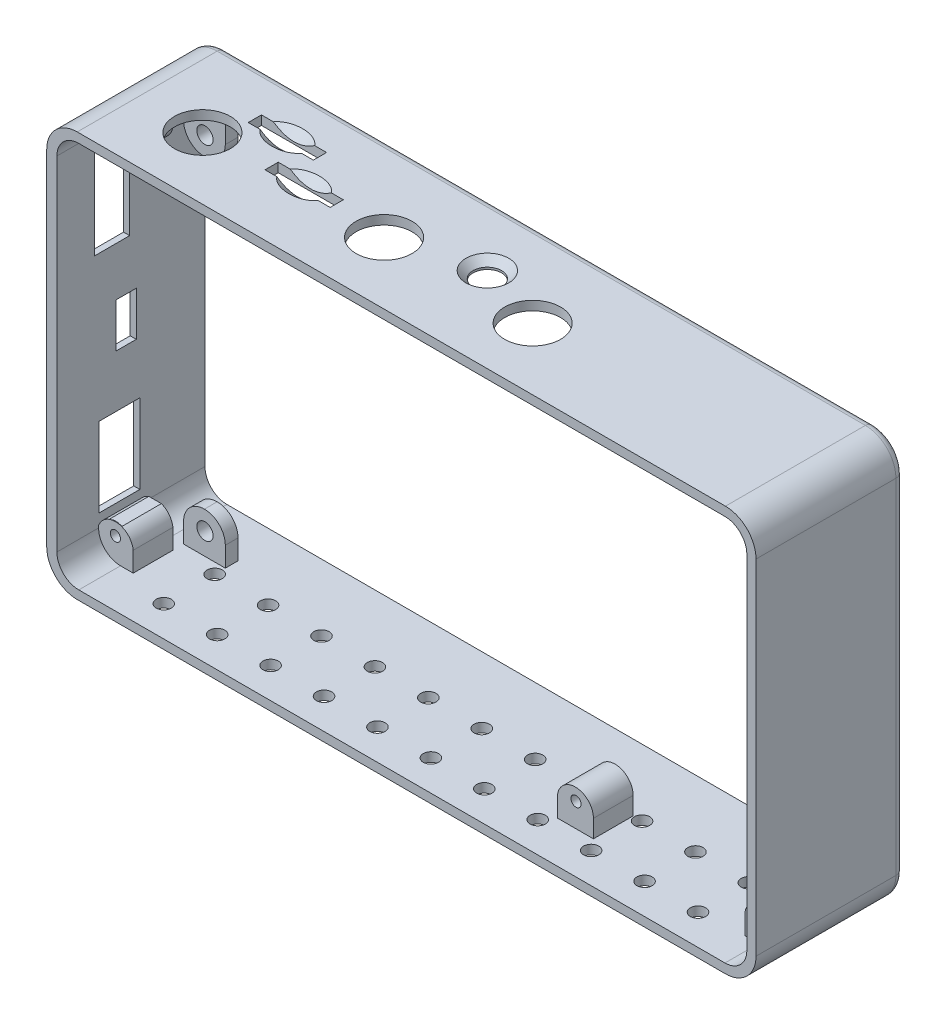
from build123d import *

# Parameters (mm, degrees)
SKETCH_2_W           = 139.4
SKETCH_2_H           = 79.6
SKETCH_2_W_2         = 135.6
SKETCH_2_H_2         = 76
EXTRUDE_1_DEPTH      = 29.1
FILLET_2_R           = 4.3
FILLET_3_R           = 6
FILLET_4_R           = 1.6
SKETCH_4_W           = 8.2
SKETCH_4_H           = 8
EXTRUDE_2_DEPTH      = 11
SKETCH_7_W           = 8.5
SKETCH_7_H           = 8
CUT_EXTRUDE_1_DEPTH  = 8.2
SKETCH_8_W           = 8.5
SKETCH_8_H           = 8
CUT_EXTRUDE_2_DEPTH  = 8.2
SKETCH_9_W           = 8.5
SKETCH_9_H           = 8
CUT_EXTRUDE_3_DEPTH  = 8.2
SKETCH_10_W          = 8.5
SKETCH_10_H          = 8
CUT_EXTRUDE_4_DEPTH  = 8.2
SKETCH_11_R          = 1.6
CUT_EXTRUDE_5_DEPTH  = 3
FILLET_5_R           = 4.1
EXTRUDE_3_DEPTH      = 16
EXTRUDE_3_2_DEPTH    = 16
EXTRUDE_3_3_DEPTH    = 16
EXTRUDE_3_4_DEPTH    = 16
EXTRUDE_3_5_DEPTH    = 16
EXTRUDE_3_6_DEPTH    = 16
CUT_EXTRUDE_6_DEPTH  = 8.2
SKETCH_14_R          = 1
CUT_EXTRUDE_7_DEPTH  = 8
EXTRUDE_START        = 1.6
SKETCH_15_R          = 1
EXTRUDE_4_DEPTH      = 1.6
SKETCH_16_R          = 5.5
SKETCH_16_R_2        = 2.8
SKETCH_16_W          = 12.8
SKETCH_16_H          = 2.6
CUT_EXTRUDE_9_DEPTH  = 2
SKETCH_17_RX         = 4.5
SKETCH_17_RY         = 3
CUT_EXTRUDE_10_DEPTH = 1.6
CUT_EXTRUDE_10_TAPER = 51
CHAMFER_1_SIZE       = 1.4
SKETCH_20_W          = 1.2
SKETCH_20_H          = 8
EXTRUDE_5_DEPTH      = 1.6
SKETCH_21_W          = 6.9
SKETCH_21_H          = 18.6
SKETCH_21_W_2        = 4
SKETCH_21_H_2        = 8.7
SKETCH_21_W_3        = 8
SKETCH_21_H_3        = 15.6
CUT_EXTRUDE_12_DEPTH = 12
SKETCH_22_W          = 8.9
SKETCH_22_H          = 20.6
SKETCH_22_W_2        = 6
SKETCH_22_H_2        = 10.7
SKETCH_22_W_3        = 10
SKETCH_22_H_3        = 17.6
CUT_EXTRUDE_14_DEPTH = 0.8
FILLET_6_R           = 0.8
SKETCH_23_W          = 2
SKETCH_23_H          = 27.1
SKETCH_23_W_2        = 3
EXTRUDE_6_DEPTH      = 2
CHAMFER_2_SIZE       = 2
SKETCH_24_R          = 1.5
CUT_EXTRUDE_15_DEPTH = 2


with BuildPart() as part:
    # Эскиз2 → Бобышка-Вытянуть1 (new body)
    with BuildSketch(Plane.XY):
        Rectangle(SKETCH_2_W, SKETCH_2_H)
        with Locations((0.1, 0)):
            Rectangle(SKETCH_2_W_2, SKETCH_2_H_2, mode=Mode.SUBTRACT)
    extrude(amount=EXTRUDE_1_DEPTH)

    # Скругление2
    fillet_2_edges = [part.edges().sort_by_distance(p)[0] for p in [
        (-67.7, -38, 14.55),
        (67.9, -38, 14.55),
        (67.9, 38, 14.55),
        (-67.7, 38, 14.55),
    ]]
    fillet(fillet_2_edges, radius=FILLET_2_R)

    # Скругление3
    fillet_3_edges = [part.edges().sort_by_distance(p)[0] for p in [
        (69.7, -39.8, 14.55),
        (-69.7, -39.8, 14.55),
        (-69.7, 39.8, 14.55),
        (69.7, 39.8, 14.55),
    ]]
    fillet(fillet_3_edges, radius=FILLET_3_R)

    # Скругление4
    fillet_4_edges = [part.edges().sort_by_distance(p)[0] for p in [
        (0, 39.8, 0),
        (69.7, 0, 0),
        (0, -39.8, 0),
        (-69.7, 0, 0),
        (-67.942640687, 38.042640687, 0),
        (-67.942640687, -38.042640687, 0),
        (67.942640687, -38.042640687, 0),
        (67.942640687, 38.042640687, 0),
    ]]
    fillet(fillet_4_edges, radius=FILLET_4_R)

    # Эскиз4 → Бобышка-Вытянуть2 (add)
    with BuildSketch(Plane(origin=(0, 0, 0), x_dir=(-1, 0, 0), z_dir=(0, 0, -1))):
        with Locations((-56.8, 34)):
            Rectangle(SKETCH_4_W, SKETCH_4_H)
        with Locations((56.8, 34)):
            Rectangle(SKETCH_4_W, SKETCH_4_H)
        with Locations((56.8, -34)):
            Rectangle(SKETCH_4_W, SKETCH_4_H)
        with Locations((-56.8, -34)):
            Rectangle(SKETCH_4_W, SKETCH_4_H)
    extrude(amount=-EXTRUDE_2_DEPTH)

    # Эскиз7 → Вырез-Вытянуть1 (cut)
    with BuildSketch(Plane(origin=(-52.7, 0, 0), x_dir=(0, 0, -1), z_dir=(1, 0, 0))):
        with Locations((-4.25, -34)):
            Rectangle(SKETCH_7_W, SKETCH_7_H)
    extrude(amount=-CUT_EXTRUDE_1_DEPTH, mode=Mode.SUBTRACT)

    # Эскиз8 → Вырез-Вытянуть2 (cut)
    with BuildSketch(Plane(origin=(-52.7, 0, 0), x_dir=(0, 0, -1), z_dir=(1, 0, 0))):
        with Locations((-4.25, 34)):
            Rectangle(SKETCH_8_W, SKETCH_8_H)
    extrude(amount=-CUT_EXTRUDE_2_DEPTH, mode=Mode.SUBTRACT)

    # Эскиз9 → Вырез-Вытянуть3 (cut)
    with BuildSketch(Plane.ZY.offset(-52.7)):
        with Locations((4.25, 34)):
            Rectangle(SKETCH_9_W, SKETCH_9_H)
    extrude(amount=-CUT_EXTRUDE_3_DEPTH, mode=Mode.SUBTRACT)

    # Эскиз10 → Вырез-Вытянуть4 (cut)
    with BuildSketch(Plane.ZY.offset(-52.7)):
        with Locations((4.25, -34)):
            Rectangle(SKETCH_10_W, SKETCH_10_H)
    extrude(amount=-CUT_EXTRUDE_4_DEPTH, mode=Mode.SUBTRACT)

    # Эскиз11 → Вырез-Вытянуть5 (cut)
    with BuildSketch(Plane.XY.offset(11)):
        with Locations((-56.7, 33.7)):
            Circle(SKETCH_11_R)
        with Locations((56.7, 33.7)):
            Circle(SKETCH_11_R)
        with Locations((56.7, -33.7)):
            Circle(SKETCH_11_R)
        with Locations((-56.7, -33.7)):
            Circle(SKETCH_11_R)
    extrude(amount=-CUT_EXTRUDE_5_DEPTH, mode=Mode.SUBTRACT)

    # Скругление5
    fillet_5_edges = [part.edges().sort_by_distance(p)[0] for p in [
        (60.9, -30, 9.75),
        (52.7, -30, 9.75),
        (52.7, 30, 9.75),
        (60.9, 30, 9.75),
        (-52.7, 30, 9.75),
        (-60.9, 30, 9.75),
        (-60.9, -30, 9.75),
        (-52.7, -30, 9.75),
    ]]
    fillet(fillet_5_edges, radius=FILLET_5_R - 0.0001)  # a hair under: the kernel refuses the full size



with BuildPart() as body_2:
    # Эскиз12 → Бобышка-Вытянуть3 (new body)
    with BuildSketch(Plane.XY.offset(29.1)):
        with BuildLine():
            Line((60.9, -34.5), (60.9, -38))
            Line((60.9, -38), (63.6, -38))
            ThreePointArc((63.6, -38), (66.488020602, -36.885802411), (67.879378138, -34.120621862))
            ThreePointArc((67.879378138, -34.120621862), (64.210030902, -31.005159268), (60.9, -34.5))
        make_face()
    extrude(amount=-EXTRUDE_3_DEPTH)


with BuildPart() as body_3:
    # Эскиз12 → Extrude 3 2 (new body)
    with BuildSketch(Plane.XY.offset(29.1)):
        with BuildLine():
            Line((22.45, -38), (29.55, -38))
            Line((29.55, -38), (29.55, -34.5))
            ThreePointArc((29.55, -34.5), (26, -30.95), (22.45, -34.5))
            Line((22.45, -34.5), (22.45, -38))
        make_face()
    extrude(amount=-EXTRUDE_3_2_DEPTH)


with BuildPart() as body_4:
    # Эскиз12 → Extrude 3 3 (new body)
    with BuildSketch(Plane.XY.offset(29.1)):
        with BuildLine():
            Line((-63.4, -38), (-60.9, -38))
            Line((-60.9, -38), (-60.9, -34.1))
            ThreePointArc((-60.9, -34.1), (-63.971720372, -31.003347807), (-67.7, -33.267117199))
            Line((-67.7, -33.267117199), (-67.7, -33.7))
            ThreePointArc((-67.7, -33.7), (-66.440559159, -36.740559159), (-63.4, -38))
        make_face()
    extrude(amount=-EXTRUDE_3_3_DEPTH)


with BuildPart() as body_5:
    # Эскиз12 → Extrude 3 4 (new body)
    with BuildSketch(Plane.XY.offset(29.1)):
        with BuildLine():
            ThreePointArc((60.9, 35.416552506), (63.483447494, 31), (67.9, 33.583447494))
            Line((67.9, 33.583447494), (67.9, 33.7))
            ThreePointArc((67.9, 33.7), (66.640559159, 36.740559159), (63.6, 38))
            Line((63.6, 38), (60.9, 38))
            Line((60.9, 38), (60.9, 35.416552506))
        make_face()
    extrude(amount=-EXTRUDE_3_4_DEPTH)


with BuildPart() as body_6:
    # Эскиз12 → Extrude 3 5 (new body)
    with BuildSketch(Plane.XY.offset(29.1)):
        with BuildLine():
            Line((29.55, 34.5), (29.55, 38))
            Line((29.55, 38), (22.45, 38))
            Line((22.45, 38), (22.45, 34.5))
            ThreePointArc((22.45, 34.5), (26, 30.95), (29.55, 34.5))
        make_face()
    extrude(amount=-EXTRUDE_3_5_DEPTH)


with BuildPart() as body_7:
    # Эскиз12 → Extrude 3 6 (new body)
    with BuildSketch(Plane.XY.offset(29.1)):
        with BuildLine():
            Line((-67.7, 33.7), (-67.7, 33.333809621))
            ThreePointArc((-67.7, 33.333809621), (-63.808392022, 31.050362338), (-60.9, 34.5))
            Line((-60.9, 34.5), (-60.9, 38))
            Line((-60.9, 38), (-63.4, 38))
            ThreePointArc((-63.4, 38), (-66.440559159, 36.740559159), (-67.7, 33.7))
        make_face()
    extrude(amount=-EXTRUDE_3_6_DEPTH)


with BuildPart() as cut_extrude_6_tool:
    # Эскиз13 → Вырез-Вытянуть6 (new body)
    with BuildSketch(Plane.XY.offset(29.1)):
        with BuildLine():
            Line((22.45, 38), (22.45, 34.5))
            ThreePointArc((22.45, 34.5), (26, 30.95), (29.55, 34.5))
            Line((29.55, 34.5), (29.55, 38))
            Line((29.55, 38), (22.45, 38))
        make_face()
        with BuildLine():
            Line((-60.9, 34.5), (-60.9, 38))
            Line((-60.9, 38), (-63.4, 38))
            ThreePointArc((-63.4, 38), (-66.440559159, 36.740559159), (-67.7, 33.7))
            Line((-67.7, 33.7), (-67.7, 33.333809621))
            ThreePointArc((-67.7, 33.333809621), (-63.808392022, 31.050362338), (-60.9, 34.5))
        make_face()
        with BuildLine():
            Line((60.9, 38), (60.9, 35.416552506))
            ThreePointArc((60.9, 35.416552506), (63.483447494, 31), (67.9, 33.583447494))
            Line((67.9, 33.583447494), (67.9, 33.7))
            ThreePointArc((67.9, 33.7), (66.640559159, 36.740559159), (63.6, 38))
            Line((63.6, 38), (60.9, 38))
        make_face()
        with BuildLine():
            Line((22.45, -34.5), (22.45, -38))
            Line((22.45, -38), (29.55, -38))
            Line((29.55, -38), (29.55, -34.5))
            ThreePointArc((29.55, -34.5), (26, -30.95), (22.45, -34.5))
        make_face()
        with BuildLine():
            Line((60.9, -34.5), (60.9, -38))
            Line((60.9, -38), (63.6, -38))
            ThreePointArc((63.6, -38), (66.488020602, -36.885802411), (67.879378138, -34.120621862))
            ThreePointArc((67.879378138, -34.120621862), (64.210030902, -31.005159268), (60.9, -34.5))
        make_face()
        with BuildLine():
            Line((-60.9, -38), (-60.9, -34.1))
            ThreePointArc((-60.9, -34.1), (-63.971720372, -31.003347807), (-67.7, -33.267117199))
            Line((-67.7, -33.267117199), (-67.7, -33.7))
            ThreePointArc((-67.7, -33.7), (-66.440559159, -36.740559159), (-63.4, -38))
            Line((-63.4, -38), (-60.9, -38))
        make_face()
    extrude(amount=-CUT_EXTRUDE_6_DEPTH)


with BuildPart() as body_2_1:
    add(body_2.part)

    # Вырез-Вытянуть6: cut by cut_extrude_6_tool
    add(cut_extrude_6_tool.part, mode=Mode.SUBTRACT)


with BuildPart() as body_3_1:
    add(body_3.part)

    # Вырез-Вытянуть6: cut by cut_extrude_6_tool
    add(cut_extrude_6_tool.part, mode=Mode.SUBTRACT)


with BuildPart() as body_4_1:
    add(body_4.part)

    # Вырез-Вытянуть6: cut by cut_extrude_6_tool
    add(cut_extrude_6_tool.part, mode=Mode.SUBTRACT)


with BuildPart() as body_5_1:
    add(body_5.part)

    # Вырез-Вытянуть6: cut by cut_extrude_6_tool
    add(cut_extrude_6_tool.part, mode=Mode.SUBTRACT)


with BuildPart() as body_6_1:
    add(body_6.part)

    # Вырез-Вытянуть6: cut by cut_extrude_6_tool
    add(cut_extrude_6_tool.part, mode=Mode.SUBTRACT)


with BuildPart() as body_7_1:
    add(body_7.part)

    # Вырез-Вытянуть6: cut by cut_extrude_6_tool
    add(cut_extrude_6_tool.part, mode=Mode.SUBTRACT)


with BuildPart() as cut_extrude_7_tool:
    # Эскиз14 → Вырез-Вытянуть7 (new body)
    with BuildSketch(Plane.XY.offset(20.9)):
        with Locations((-64.4, 34.5)):
            Circle(SKETCH_14_R)
        with Locations((-64.4, -33.4)):
            Circle(SKETCH_14_R)
        with Locations((64.4, -34.5)):
            Circle(SKETCH_14_R)
        with Locations((64.4, 34.5)):
            Circle(SKETCH_14_R)
        with Locations((26.127466667, 34.618766667)):
            Circle(SKETCH_14_R)
        with Locations((26.127466667, -33.326233333)):
            Circle(SKETCH_14_R)
    extrude(amount=-CUT_EXTRUDE_7_DEPTH)


with BuildPart() as body_2_2:
    add(body_2_1.part)

    # Вырез-Вытянуть7: cut by cut_extrude_7_tool
    add(cut_extrude_7_tool.part, mode=Mode.SUBTRACT)


with BuildPart() as body_3_2:
    add(body_3_1.part)

    # Вырез-Вытянуть7: cut by cut_extrude_7_tool
    add(cut_extrude_7_tool.part, mode=Mode.SUBTRACT)


with BuildPart() as body_4_2:
    add(body_4_1.part)

    # Вырез-Вытянуть7: cut by cut_extrude_7_tool
    add(cut_extrude_7_tool.part, mode=Mode.SUBTRACT)


with BuildPart() as body_5_2:
    add(body_5_1.part)

    # Вырез-Вытянуть7: cut by cut_extrude_7_tool
    add(cut_extrude_7_tool.part, mode=Mode.SUBTRACT)


with BuildPart() as body_6_2:
    add(body_6_1.part)

    # Вырез-Вытянуть7: cut by cut_extrude_7_tool
    add(cut_extrude_7_tool.part, mode=Mode.SUBTRACT)


with BuildPart() as body_7_2:
    add(body_7_1.part)

    # Вырез-Вытянуть7: cut by cut_extrude_7_tool
    add(cut_extrude_7_tool.part, mode=Mode.SUBTRACT)


with BuildPart() as part_1:
    add(part.part)

    add(body_2_2.part)  # Бобышка-Вытянуть4 merges body 2

    add(body_5_2.part)  # Бобышка-Вытянуть4 merges body 5
    # Эскиз15 → Бобышка-Вытянуть4 (add)
    # profile 1 of 2: a face of its own
    with BuildSketch(Plane.XY.offset(20.9).offset(EXTRUDE_START)):
        with BuildLine():
            Line((63.6, 38), (60.9, 38))
            Line((60.9, 38), (60.9, 35.416552506))
            ThreePointArc((60.9, 35.416552506), (63.483447494, 31), (67.9, 33.583447494))
            Line((67.9, 33.583447494), (67.9, 33.7))
            ThreePointArc((67.9, 33.7), (66.640559159, 36.740559159), (63.6, 38))
        make_face()
        with Locations((64.4, 34.5)):
            Circle(SKETCH_15_R, mode=Mode.SUBTRACT)
    # profile 2 of 2: a face of its own
    with BuildSketch(Plane.XY.offset(20.9).offset(EXTRUDE_START)):
        with BuildLine():
            Line((60.9, -34.5), (60.9, -38))
            Line((60.9, -38), (63.6, -38))
            ThreePointArc((63.6, -38), (66.488020602, -36.885802411), (67.879378138, -34.120621862))
            ThreePointArc((67.879378138, -34.120621862), (64.210030902, -31.005159268), (60.9, -34.5))
        make_face()
        with Locations((64.4, -34.5)):
            Circle(SKETCH_15_R, mode=Mode.SUBTRACT)
    extrude(amount=-EXTRUDE_4_DEPTH)

    # Эскиз16 → Вырез-Вытянуть9 (cut)
    with BuildSketch(Plane(origin=(0, 39.8, 0), x_dir=(1, 0, 0), z_dir=(0, 1, 0))):
        with Locations(Location((-51.3, -16.9, 0), (0, 0, 180))):
            Circle(SKETCH_16_R)
        with Locations(Location((-15.6, -16.9, 0), (0, 0, 180))):
            Circle(SKETCH_16_R)
        with Locations(Location((0.2, -12.4, 0), (0, 0, 180))):
            Circle(SKETCH_16_R_2)
        with Locations(Location((13.6, -16.9, 0), (0, 0, 180))):
            Circle(SKETCH_16_R)
        with Locations((-42.1, -9.4)):
            Rectangle(SKETCH_16_W, SKETCH_16_H)
        with Locations((-32.4, -15.8)):
            Rectangle(SKETCH_16_W, SKETCH_16_H)
    extrude(amount=-CUT_EXTRUDE_9_DEPTH, mode=Mode.SUBTRACT)

    # Эскиз17 → Вырез-Вытянуть10 (cut)
    with BuildSketch(Plane(origin=(0, 39.8, 0), x_dir=(1, 0, 0), z_dir=(0, 1, 0))):
        with Locations((-42.1, -9.404642064)):
            Ellipse(SKETCH_17_RX, SKETCH_17_RY)
        with Locations((-32.4, -15.81443459)):
            Ellipse(SKETCH_17_RX, SKETCH_17_RY)
    extrude(amount=-CUT_EXTRUDE_10_DEPTH, taper=CUT_EXTRUDE_10_TAPER, mode=Mode.SUBTRACT)

    # Фаска1
    chamfer_1_edges = [part_1.edges().sort_by_distance(p)[0] for p in [
        (3, 39.8, 12.4),
    ]]
    chamfer(chamfer_1_edges, length=CHAMFER_1_SIZE)

    # Эскиз20 → Бобышка-Вытянуть5 (add)
    with BuildSketch(Plane.XZ.offset(-38)):
        with Locations((-43.3, 16.9)):
            Rectangle(SKETCH_20_W, SKETCH_20_H)
        with Locations((-8, 16.9)):
            Rectangle(SKETCH_20_W, SKETCH_20_H)
        with Locations((20.8, 16.9)):
            Rectangle(SKETCH_20_W, SKETCH_20_H)
    extrude(amount=EXTRUDE_5_DEPTH)


with BuildPart() as cut_extrude_12_tool:
    # Эскиз21 → Вырез-Вытянуть12 (new body)
    with BuildSketch(Plane.ZY.offset(69.7)):
        with Locations((18.25, 22.3)):
            Rectangle(SKETCH_21_W, SKETCH_21_H)
        with Locations((15.5, -0.95)):
            Rectangle(SKETCH_21_W_2, SKETCH_21_H_2)
        with Locations((16.8, -23.4)):
            Rectangle(SKETCH_21_W_3, SKETCH_21_H_3)
    extrude(amount=-CUT_EXTRUDE_12_DEPTH)


with BuildPart() as part_2:
    add(part_1.part)

    # Вырез-Вытянуть12: cut by cut_extrude_12_tool
    add(cut_extrude_12_tool.part, mode=Mode.SUBTRACT)

    # Эскиз22 → Вырез-Вытянуть14 (cut)
    with BuildSketch(Plane.ZY.offset(69.7)):
        with Locations((18.25, 22.3)):
            Rectangle(SKETCH_22_W, SKETCH_22_H)
        with Locations((15.5, -0.95)):
            Rectangle(SKETCH_22_W_2, SKETCH_22_H_2)
        with Locations((16.8, -23.4)):
            Rectangle(SKETCH_22_W_3, SKETCH_22_H_3)
    extrude(amount=-CUT_EXTRUDE_14_DEPTH, mode=Mode.SUBTRACT)

    # Скругление6
    fillet_6_edges = [part_2.edges().sort_by_distance(p)[0] for p in [
        (-69.7, 12, 18.25),
        (-69.7, 22.3, 22.7),
        (-69.7, 32.6, 18.25),
        (-69.7, 22.3, 13.8),
        (-69.7, -32.2, 16.8),
        (-69.7, -23.4, 11.8),
        (-69.7, -23.4, 21.8),
        (-69.7, -14.6, 16.8),
        (-69.7, -6.3, 15.5),
        (-69.7, -0.95, 12.5),
        (-69.7, 4.4, 15.5),
        (-69.7, -0.95, 18.5),
    ]]
    fillet(fillet_6_edges, radius=FILLET_6_R - 0.0001)  # a hair under: the kernel refuses the full size

    # Эскиз23 → Бобышка-Вытянуть6 (add)
    with BuildSketch(Plane.XZ.offset(39.8)):
        with Locations((-59.7, 15.55)):
            Rectangle(SKETCH_23_W, SKETCH_23_H)
        with Locations((59.2, 15.55)):
            Rectangle(SKETCH_23_W_2, SKETCH_23_H)
    extrude(amount=EXTRUDE_6_DEPTH)

    # Фаска2
    chamfer_2_edges = [part_2.edges().sort_by_distance(p)[0] for p in [
        (-59.7, -41.8, 29.1),
        (-59.7, -41.8, 2),
        (59.2, -41.8, 2),
        (59.2, -41.8, 29.1),
    ]]
    chamfer(chamfer_2_edges, length=CHAMFER_2_SIZE - 0.0001)  # a hair under: the kernel refuses the full size

    # Эскиз24 → Вырез-Вытянуть15 (cut)
    with BuildSketch(Plane.XZ.offset(39.8)):
        with Locations(Location((-52.7, 23.1, 0), (0, 0, 270))):
            Circle(SKETCH_24_R)
        with Locations(Location((-42.2, 23.1, 0), (0, 0, 270))):
            Circle(SKETCH_24_R)
        with Locations(Location((-31.7, 23.1, 0), (0, 0, 270))):
            Circle(SKETCH_24_R)
        with Locations(Location((-21.2, 23.1, 0), (0, 0, 270))):
            Circle(SKETCH_24_R)
        with Locations(Location((-10.7, 23.1, 0), (0, 0, 270))):
            Circle(SKETCH_24_R)
        with Locations(Location((-0.2, 23.1, 0), (0, 0, 270))):
            Circle(SKETCH_24_R)
        with Locations(Location((10.3, 23.1, 0), (0, 0, 270))):
            Circle(SKETCH_24_R)
        with Locations(Location((20.8, 23.1, 0), (0, 0, 270))):
            Circle(SKETCH_24_R)
        with Locations(Location((31.3, 23.1, 0), (0, 0, 270))):
            Circle(SKETCH_24_R)
        with Locations(Location((41.8, 23.1, 0), (0, 0, 270))):
            Circle(SKETCH_24_R)
        with Locations(Location((52.3, 23.1, 0), (0, 0, 270))):
            Circle(SKETCH_24_R)
        with Locations(Location((-42.2, 13.1, 0), (0, 0, 270))):
            Circle(SKETCH_24_R)
        with Locations(Location((-31.7, 13.1, 0), (0, 0, 270))):
            Circle(SKETCH_24_R)
        with Locations(Location((-21.2, 13.1, 0), (0, 0, 270))):
            Circle(SKETCH_24_R)
        with Locations(Location((-10.7, 13.1, 0), (0, 0, 270))):
            Circle(SKETCH_24_R)
        with Locations(Location((-0.2, 13.1, 0), (0, 0, 270))):
            Circle(SKETCH_24_R)
        with Locations(Location((10.3, 13.1, 0), (0, 0, 270))):
            Circle(SKETCH_24_R)
        with Locations(Location((20.8, 13.1, 0), (0, 0, 270))):
            Circle(SKETCH_24_R)
        with Locations(Location((31.3, 13.1, 0), (0, 0, 270))):
            Circle(SKETCH_24_R)
        with Locations(Location((41.8, 13.1, 0), (0, 0, 270))):
            Circle(SKETCH_24_R)
        with Locations(Location((52.3, 13.1, 0), (0, 0, 270))):
            Circle(SKETCH_24_R)
        with Locations(Location((-52.7, 13.1, 0), (0, 0, 270))):
            Circle(SKETCH_24_R)
    extrude(amount=-CUT_EXTRUDE_15_DEPTH, mode=Mode.SUBTRACT)


with BuildPart() as body_4_3:
    add(body_4_2.part)

    # Вырез-Вытянуть12: cut by cut_extrude_12_tool
    add(cut_extrude_12_tool.part, mode=Mode.SUBTRACT)


with BuildPart() as body_7_3:
    add(body_7_2.part)

    # Вырез-Вытянуть12: cut by cut_extrude_12_tool
    add(cut_extrude_12_tool.part, mode=Mode.SUBTRACT)


solid = Compound([body_3_2.part, body_6_2.part, part_2.part, body_4_3.part, body_7_3.part])
